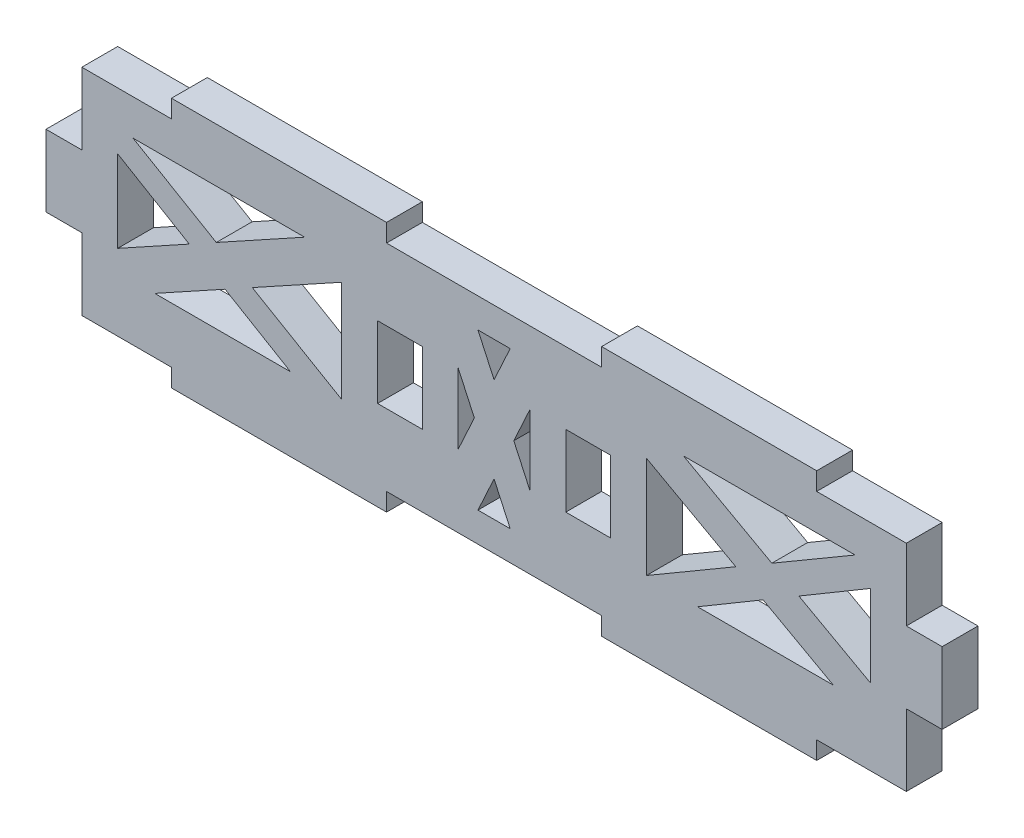
from build123d import *

# Parameters (mm, degrees)
SKETCH1_W           = 317.5
SKETCH1_H           = 76.2
BOSS_EXTRUDE1_DEPTH = 12.7
SKETCH2_W           = 76.2
SKETCH2_H           = 6.35
BOSS_EXTRUDE2_DEPTH = 12.7
SKETCH3_W           = 12.7
SKETCH3_H           = 25.4
SKETCH3_W_2         = 15.875
CUT_EXTRUDE1_DEPTH  = 166.344050392
CUT_EXTRUDE2_DEPTH  = 166.344050392


with BuildPart() as part:
    # Sketch1 → Boss-Extrude1 (new body)
    with BuildSketch(Plane.XY):
        Rectangle(SKETCH1_W, SKETCH1_H)
    extrude(amount=BOSS_EXTRUDE1_DEPTH)

    # Sketch2 → Boss-Extrude2 (add)
    with BuildSketch(Plane.XY.offset(12.7)):
        with Locations((-76.2, -41.275)):
            Rectangle(SKETCH2_W, SKETCH2_H)
        with Locations((76.2, -41.275)):
            Rectangle(SKETCH2_W, SKETCH2_H)
        with Locations((76.2, 41.275)):
            Rectangle(SKETCH2_W, SKETCH2_H)
        with Locations((-76.2, 41.275)):
            Rectangle(SKETCH2_W, SKETCH2_H)
    extrude(amount=-BOSS_EXTRUDE2_DEPTH)

    # Sketch3 → Cut-Extrude1 (cut, through all)
    with BuildSketch(Plane.XY.offset(12.7)):
        with Locations((-152.4, -25.4)):
            Rectangle(SKETCH3_W, SKETCH3_H)
        with Locations((-152.4, 25.4)):
            Rectangle(SKETCH3_W, SKETCH3_H)
        with Locations((152.4, 25.4)):
            Rectangle(SKETCH3_W, SKETCH3_H)
        with Locations((152.4, -25.4)):
            Rectangle(SKETCH3_W, SKETCH3_H)
        with Locations((33.3375, 0)):
            Rectangle(SKETCH3_W_2, SKETCH3_H)
        with Locations((-33.3375, 0)):
            Rectangle(SKETCH3_W_2, SKETCH3_H)
    extrude(amount=-CUT_EXTRUDE1_DEPTH, mode=Mode.SUBTRACT)

    # Sketch4 → Cut-Extrude2 (cut, through all)
    with BuildSketch(Plane.XY.offset(12.7)):
        Polygon((-95.309125936, -4.657389777), (-120.205106965, -18.393103448), (-72.104902526, -18.393103448), align=None)
        Polygon((-133.35, 17.860862384), (-133.35, -11.140748671), (-107.991693016, 2.85004139), align=None)
        Polygon((-85.651314146, 0.671058107), (-53.975, -17.860862384), (-53.975, 18.147645222), align=None)
        Polygon((-67.119893035, 25.4), (-127.920097474, 25.4), (-98.410958103, 8.1359641), align=None)
        Polygon((53.975, -17.860862384), (85.651314146, 0.671058107), (53.975, 18.147645222), align=None)
        Polygon((95.309125936, -4.657389777), (72.104902526, -18.393103448), (120.205106965, -18.393103448), align=None)
        Polygon((127.920097474, 25.4), (67.119893035, 25.4), (98.410958103, 8.1359641), align=None)
        Polygon((107.991693016, 2.85004139), (133.35, -11.140748671), (133.35, 17.860862384), align=None)
        Polygon((-6.988546096, 0), (-12.7, 12.427106699), (-12.7, -12.427106699), align=None)
        Polygon((5.711453904, -27.632938607), (0, -15.205831908), (-5.711453904, -27.632938607), align=None)
        Polygon((-5.711453904, 27.632938607), (0, 15.205831908), (5.711453904, 27.632938607), align=None)
        Polygon((12.7, 12.427106699), (6.988546096, 0), (12.7, -12.427106699), align=None)
    extrude(amount=-CUT_EXTRUDE2_DEPTH, mode=Mode.SUBTRACT)


solid = part.part
